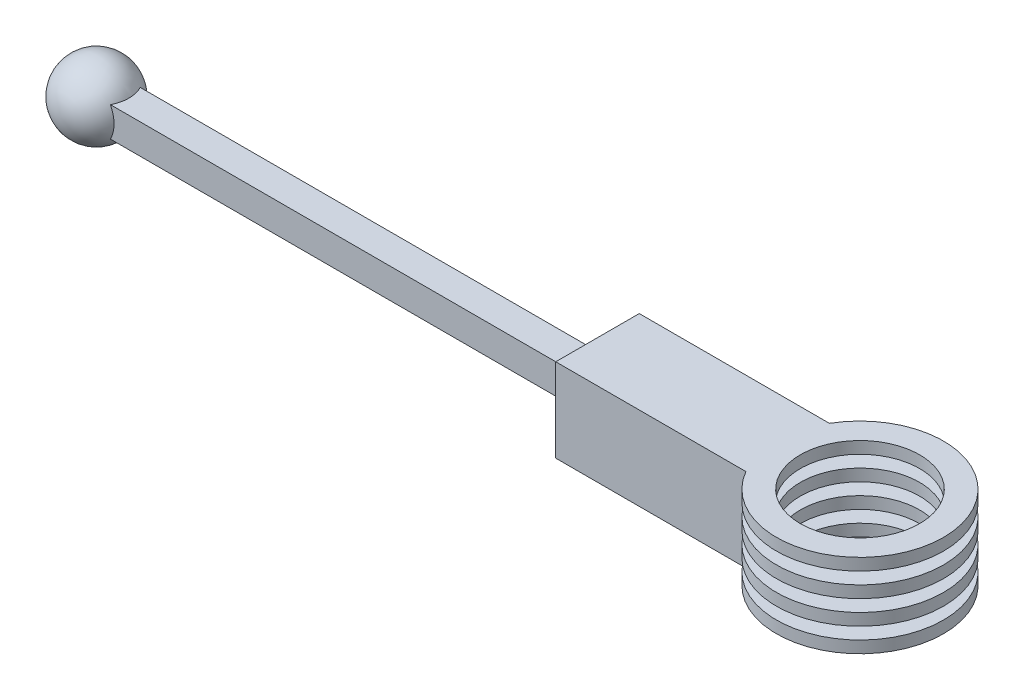
from build123d import *

# Parameters (mm, degrees)
SKETCH5_W                            = 127
SKETCH5_H                            = 127
BOSS_EXTRUDE1_DEPTH                  = 1625.6
BOSS_EXTRUDE1_DIRECTION_2_REACH      = 745.14
BOSS_EXTRUDE1_DIRECTION_2_END_RADIUS = 152.4
SKETCH6_W                            = 355.6
SKETCH6_H                            = 355.6
BOSS_EXTRUDE2_DEPTH                  = 762
SKETCH7_R                            = 355.6
BOSS_EXTRUDE3_DEPTH                  = 355.6
BOSS_EXTRUDE4_REACH                  = 3097.154
BOSS_EXTRUDE4_END_RADIUS             = 355.6
SKETCH8_W                            = 355.6
SKETCH8_H                            = 355.6
SKETCH9_R                            = 254
CUT_EXTRUDE1_DEPTH                   = 355.6
SKETCH11_W                           = 355.6
SKETCH11_H                           = 50.8


with BuildPart() as part:
    # Sketch3 → Revolve1 (revolve)
    with BuildSketch(Plane(origin=(0, 0, 0), x_dir=(1, 0, 0), z_dir=(0, 1, 0))):
        with BuildLine():
            Line((-508, 0), (-508, 304.8))
            ThreePointArc((-508, 304.8), (-355.6, 152.4), (-508, 0))
        make_face()
    revolve(axis=Axis((-508, 0, 0), (0, 0, -1)))

    # Sketch5 → Boss-Extrude1 (add)
    with BuildSketch(Plane(origin=(0, 0, 0), x_dir=(0, 0, -1), z_dir=(1, 0, 0))):
        with Locations((152.4, 0)):
            Rectangle(SKETCH5_W, SKETCH5_H)
    extrude(amount=BOSS_EXTRUDE1_DEPTH)

    # Boss-Extrude1 direction 2: up to this sphere (the profile starts outside it)
    boss_extrude1_direction_2_end = Location((-508, 0, -152.4)) * Sphere(BOSS_EXTRUDE1_DIRECTION_2_END_RADIUS, mode=Mode.PRIVATE)
    # Sketch5 → Boss-Extrude1 direction 2 (add, up to the surface)
    with BuildSketch(Plane(origin=(0, 0, 0), x_dir=(0, 0, -1), z_dir=(1, 0, 0)), mode=Mode.PRIVATE) as boss_extrude1_direction_2_sk1:
        with Locations((152.4, 0)):
            Rectangle(SKETCH5_W, SKETCH5_H)
    boss_extrude1_direction_2_tool1 = extrude(boss_extrude1_direction_2_sk1.sketch, amount=-BOSS_EXTRUDE1_DIRECTION_2_REACH, mode=Mode.PRIVATE) - boss_extrude1_direction_2_end
    add(boss_extrude1_direction_2_tool1.solids().sort_by_distance((0, 0, -152.4))[0])

    # Sketch6 → Boss-Extrude2 (add)
    with BuildSketch(Plane(origin=(1625.6, 0, 0), x_dir=(0, 0, -1), z_dir=(1, 0, 0))):
        with Locations((152.4, 0)):
            Rectangle(SKETCH6_W, SKETCH6_H)
    extrude(amount=BOSS_EXTRUDE2_DEPTH)



with BuildPart() as body_2:
    # Sketch7 → Boss-Extrude3 (new body)
    with BuildSketch(Plane(origin=(0, 177.8, 0), x_dir=(1, 0, 0), z_dir=(0, 1, 0))):
        with Locations((2743.2, 152.4)):
            Circle(SKETCH7_R)
    extrude(amount=-BOSS_EXTRUDE3_DEPTH)


with BuildPart() as part_1:
    add(part.part)

    add(body_2.part)  # Boss-Extrude4 merges body 2
    # Boss-Extrude4: up to this cylinder (the profile starts outside it)
    boss_extrude4_end = Plane(origin=(2743.2, 0, -152.4), z_dir=(0, 1, 0)) * Cylinder(BOSS_EXTRUDE4_END_RADIUS, 6906.508, mode=Mode.PRIVATE)
    # Sketch8 → Boss-Extrude4 (add, up to the surface)
    with BuildSketch(Plane(origin=(2387.6, 0, 0), x_dir=(0, 0, -1), z_dir=(1, 0, 0)), mode=Mode.PRIVATE) as boss_extrude4_sk1:
        with Locations((152.4, 0)):
            Rectangle(SKETCH8_W, SKETCH8_H)
    boss_extrude4_tool1 = extrude(boss_extrude4_sk1.sketch, amount=BOSS_EXTRUDE4_REACH, mode=Mode.PRIVATE) - boss_extrude4_end
    add(boss_extrude4_tool1.solids().sort_by_distance((2387.6, 0, -152.4))[0])
    add(boss_extrude4_tool1.solids().sort_by_distance((2387.6, 0, -152.4))[1])

    # Sketch9 → Cut-Extrude1 (cut)
    with BuildSketch(Plane(origin=(0, 177.8, 0), x_dir=(1, 0, 0), z_dir=(0, 1, 0))):
        with Locations((2743.2, 152.4)):
            Circle(SKETCH9_R)
    extrude(amount=-CUT_EXTRUDE1_DEPTH, mode=Mode.SUBTRACT)

    # Sketch11 → Cut-Revolve1 (revolve, cut)
    with BuildSketch(Plane.XY.offset(-152.4)):
        with Locations((2921, 101.6)):
            Rectangle(SKETCH11_W, SKETCH11_H)
        with Locations((2921, 0)):
            Rectangle(SKETCH11_W, SKETCH11_H)
        with Locations((2921, -101.6)):
            Rectangle(SKETCH11_W, SKETCH11_H)
    revolve(axis=Axis((2743.2, 177.8, -152.4), (0, -1, 0)), mode=Mode.SUBTRACT)


with BuildPart() as body_2_2:
    # Split1: the piece on the far side of the plane
    add(part_1.part)
    split(bisect_by=Plane(origin=(1625.6, 0, 0), x_dir=(0, 0, 1), z_dir=(1, 0, 0)), keep=Keep.BOTTOM)


with BuildPart() as part_2:
    add(part_1.part)

    # Split1
    split(bisect_by=Plane(origin=(1625.6, 0, 0), x_dir=(0, 0, 1), z_dir=(1, 0, 0)), keep=Keep.TOP)


solid = Compound([body_2_2.part, part_2.part])
